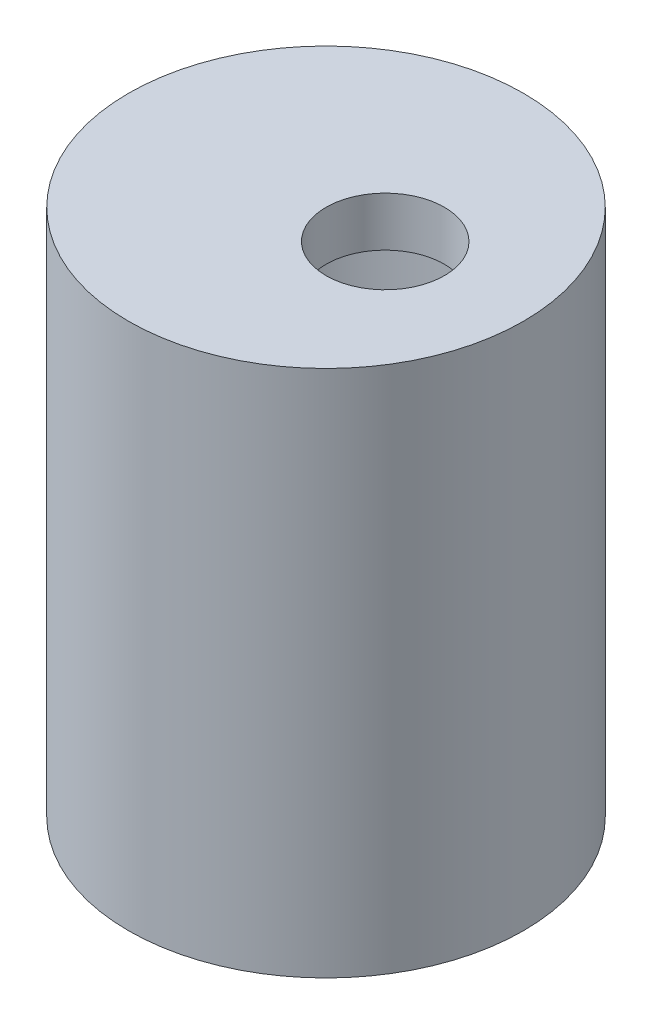
from build123d import *

# Parameters (mm, degrees)
SCHIZZO2_R               = 6
TAGLIO_ESTRUSIONE1_DEPTH = 11


with BuildPart() as part:
    # Schizzo1 → Rivoluzione1 (revolve)
    with BuildSketch(Plane.XY):
        Polygon((-18, 0), (-14, 0), (-14, 38), (0, 38), (0, 43), (-20, 43), (-20, -10.457904347), (-18, -10.457904347), align=None)
    revolve(axis=Axis((0, 0, 0), (0, 1, 0)))

    # Schizzo2 → Taglio-Estrusione1 (cut)
    with BuildSketch(Plane(origin=(0, 43, 0), x_dir=(1, 0, 0), z_dir=(0, 1, 0))):
        with Locations((6, 0)):
            Circle(SCHIZZO2_R)
    extrude(amount=-TAGLIO_ESTRUSIONE1_DEPTH, mode=Mode.SUBTRACT)


solid = part.part
